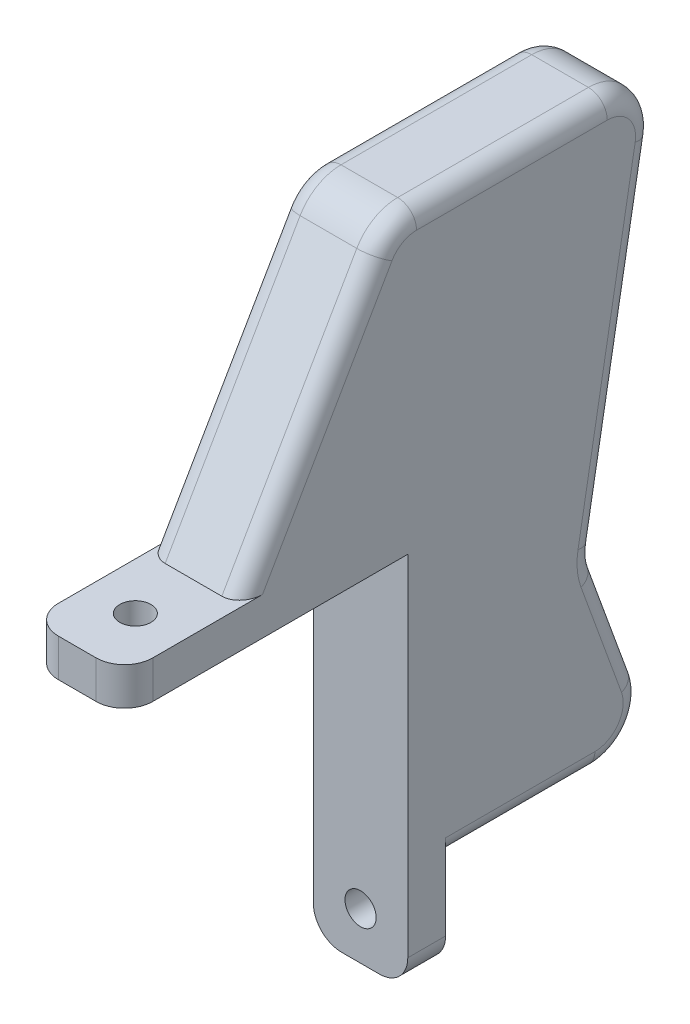
from build123d import *

# Parameters (mm, degrees)
BOSS_EXTRUDE1_DEPTH = 10
FILLET1_R           = 5
BOSS_EXTRUDE2_DEPTH = 4
SKETCH3_R           = 1.65
CUT_EXTRUDE1_DEPTH  = 59.164508804
BOSS_EXTRUDE3_DEPTH = 4
SKETCH5_R           = 1.65
CUT_EXTRUDE2_DEPTH  = 54.441556864
FILLET2_R           = 3
FILLET3_R           = 2


with BuildPart() as part:
    # Sketch1 → Boss-Extrude1 (new body)
    with BuildSketch(Plane(origin=(0, 0, 0), x_dir=(0, 0, -1), z_dir=(1, 0, 0))):
        Polygon((0, 0), (20, 0), (20, -30), (46.948227033, -30), (39.761342181, -10.254196155), (47.07937165, 31.248411326), (18.041278691, 31.248411326), align=None)
    extrude(amount=BOSS_EXTRUDE1_DEPTH)

    # Fillet1
    fillet1_edges = [part.edges().sort_by_distance(p)[0] for p in [
        (5, -30, -46.948227033),
        (5, -10.254196155, -39.761342181),
        (5, 31.248411326, -47.07937165),
        (5, 31.248411326, -18.041278691),
    ]]
    fillet(fillet1_edges, radius=FILLET1_R)

    # Sketch2 → Boss-Extrude2 (add)
    with BuildSketch(Plane.XZ):
        Polygon((0, -20), (0, 0), (0, 10), (10, 10), (10, 0), (10, -20), align=None)
    extrude(amount=-BOSS_EXTRUDE2_DEPTH)

    # Sketch3 → Cut-Extrude1 (cut, through all)
    with BuildSketch(Plane(origin=(0, 4, 0), x_dir=(1, 0, 0), z_dir=(0, 1, 0))):
        with Locations((5, -3.845299462)):
            Circle(SKETCH3_R)
    extrude(amount=-CUT_EXTRUDE1_DEPTH, mode=Mode.SUBTRACT)

    # Sketch4 → Boss-Extrude3 (add)
    with BuildSketch(Plane.XY.offset(-20)):
        Polygon((0, 0), (0, -30), (0, -40), (10, -40), (10, -30), (10, 0), align=None)
    extrude(amount=-BOSS_EXTRUDE3_DEPTH)

    # Sketch5 → Cut-Extrude2 (cut, through all)
    with BuildSketch(Plane(origin=(0, 0, -24), x_dir=(-1, 0, 0), z_dir=(0, 0, -1))):
        with Locations((-5, -35)):
            Circle(SKETCH5_R)
    extrude(amount=-CUT_EXTRUDE2_DEPTH, mode=Mode.SUBTRACT)

    # Fillet2
    fillet2_edges = [part.edges().sort_by_distance(p)[0] for p in [
        (0, -40, -22),
        (10, -40, -22),
        (0, 2, 10),
        (10, 2, 10),
    ]]
    fillet(fillet2_edges, radius=FILLET2_R)

    # Fillet3
    fillet3_edges = [part.edges().sort_by_distance(p)[0] for p in [
        (0, -30, -31.9037435),
        (0, -27.867882182, -43.903247221),
        (0, -17.401522416, -42.362756195),
        (0, -10.238823546, -39.937051901),
        (0, 8.222683247, -43.019314539),
        (0, 29.462349374, -44.950825903),
        (0, 31.248411326, -31.024316862),
        (0, 30.578538345, -18.428030037),
        (10, -30, -31.9037435),
        (10, -27.867882182, -43.903247221),
        (10, -17.401522416, -42.362756195),
        (10, -10.238823546, -39.937051901),
        (10, 8.222683247, -43.019314539),
        (10, 29.462349374, -44.950825903),
        (10, 31.248411326, -31.024316862),
        (10, 30.578538345, -18.428030037),
        (0, 16.374205663, -9.453652047),
        (10, 16.374205663, -9.453652047),
    ]]
    fillet(fillet3_edges, radius=FILLET3_R)


solid = part.part
